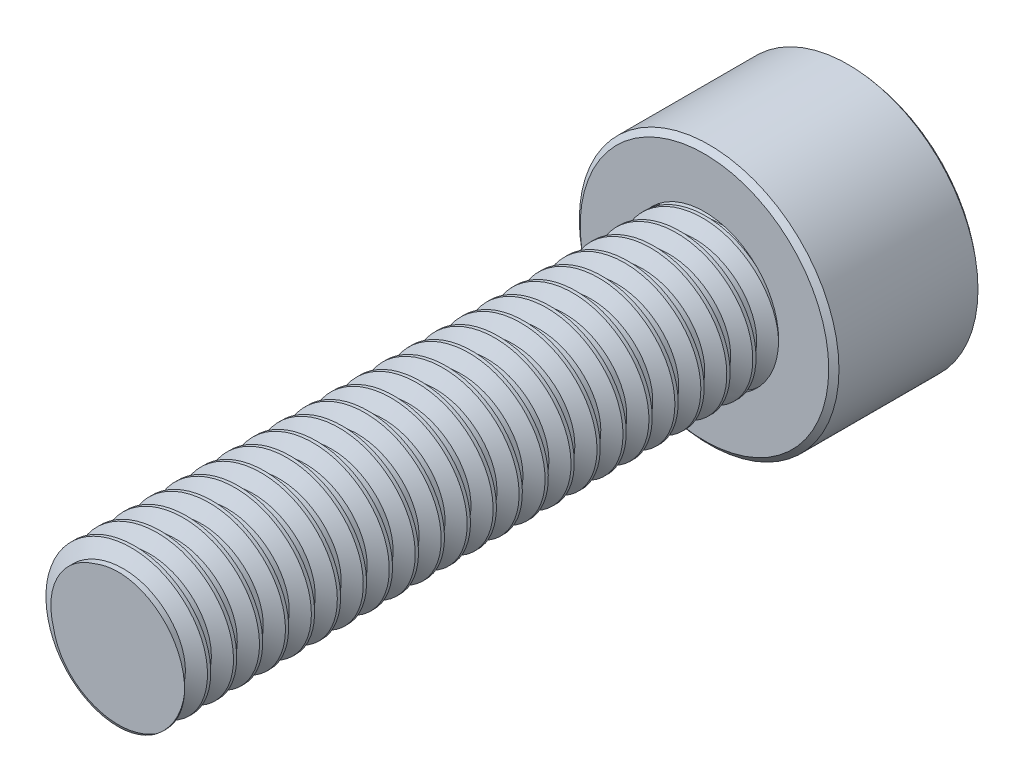
from build123d import *

# Parameters (mm, degrees)
SKETCH3_R           = 2
BOSS_EXTRUDE2_DEPTH = 16
SKETCH4_R           = 3.5
BOSS_EXTRUDE3_DEPTH = 4
SKETCH5_OUTSIDE_W   = 22.998
SKETCH5_OUTSIDE_H   = 22.998
SKETCH5_OUTSIDE_R   = 3.35
CUT_EXTRUDE1_DEPTH  = 4
CUT_EXTRUDE1_DRAFT  = -50
SKETCH6_OUTSIDE_W   = 22.998
SKETCH6_OUTSIDE_H   = 22.998
SKETCH6_OUTSIDE_R   = 3.35
CUT_EXTRUDE2_DEPTH  = 4
CUT_EXTRUDE2_DRAFT  = -50
THREAD1_PITCH       = 0.7
CUT_EXTRUDE3_DEPTH  = 2.8
FILLET2_R           = 0.1
FILLET3_R           = 0.1


with BuildPart() as part:
    # Sketch3 → Boss-Extrude2 (new body)
    with BuildSketch(Plane.XY):
        Circle(SKETCH3_R)
    extrude(amount=BOSS_EXTRUDE2_DEPTH)

    # Sketch4 → Boss-Extrude3 (add)
    with BuildSketch(Plane(origin=(0, 0, 0), x_dir=(-1, 0, 0), z_dir=(0, 0, -1))):
        Circle(SKETCH4_R)
    extrude(amount=BOSS_EXTRUDE3_DEPTH)


with BuildPart() as cut_extrude1_tool:
    # Sketch5 outside → Cut-Extrude1 (with draft: the straight prism first)
    with BuildSketch(Plane(origin=(0, 0, -4), x_dir=(-1, 0, 0), z_dir=(0, 0, -1))):
        Rectangle(SKETCH5_OUTSIDE_W, SKETCH5_OUTSIDE_H)
        Circle(SKETCH5_OUTSIDE_R, mode=Mode.SUBTRACT)
    extrude(amount=-CUT_EXTRUDE1_DEPTH)
    # Cut-Extrude1: the draft: its side faces are tilted about the plane it starts from
    cut_extrude1_sides = [cut_extrude1_tool.faces().sort_by_distance(p)[0] for p in [
        (0, -11.499, -2),
        (-11.499, 0, -2),
        (0, 11.499, -2),
        (11.499, 0, -2),
        (3.35, 0, -2),
    ]]
    draft(cut_extrude1_sides, Plane(origin=(0, 0, -4), x_dir=(-1, 0, 0), z_dir=(0, 0, -1)), CUT_EXTRUDE1_DRAFT)


with BuildPart() as part_1:
    add(part.part)

    # Cut-Extrude1: cut by cut_extrude1_tool
    add(cut_extrude1_tool.part, mode=Mode.SUBTRACT)


with BuildPart() as cut_extrude2_tool:
    # Sketch6 outside → Cut-Extrude2 (with draft: the straight prism first)
    with BuildSketch(Plane.XY):
        Rectangle(SKETCH6_OUTSIDE_W, SKETCH6_OUTSIDE_H)
        Circle(SKETCH6_OUTSIDE_R, mode=Mode.SUBTRACT)
    extrude(amount=-CUT_EXTRUDE2_DEPTH)
    # Cut-Extrude2: the draft: its side faces are tilted about the plane it starts from
    cut_extrude2_sides = [cut_extrude2_tool.faces().sort_by_distance(p)[0] for p in [
        (0, -11.499, -2),
        (11.499, 0, -2),
        (0, 11.499, -2),
        (-11.499, 0, -2),
        (-3.35, 0, -2),
    ]]
    draft(cut_extrude2_sides, Plane.XY, CUT_EXTRUDE2_DRAFT)


with BuildPart() as part_2:
    add(part_1.part)

    # Cut-Extrude2: cut by cut_extrude2_tool
    add(cut_extrude2_tool.part, mode=Mode.SUBTRACT)

    # Thread1: the profile of Thread Profile1 profile screwed along a right-hand helix of 28.571429 turns, 6 arcs to a turn; built about Z, then put on its axis
    thread1_z = Axis((0, 0, 0), (0, 0, 1))
    thread1_corners = [(2.0003, 0, -0.000173205), (2.0003, 0, 0.612673203), (1.621113888, 0, 0.393749999), (1.621113888, 0, 0.218749999)]
    with BuildLine(mode=Mode.PRIVATE) as thread1_profile:
        Line(thread1_corners[0], thread1_corners[1])
        Line(thread1_corners[1], thread1_corners[2])
        Line(thread1_corners[2], thread1_corners[3])
        Line(thread1_corners[3], thread1_corners[0])
    thread1_cap = Face(thread1_profile.wire())
    thread1_turn_angles = [0, 30, 60, 90, 120, 150, 180, 210, 240, 270, 300, 330, 360]
    thread1_turn_weights = [1, 0.8660254037844387, 1, 0.8660254037844387, 1, 0.8660254037844387, 1, 0.8660254037844387, 1, 0.8660254037844387, 1, 0.8660254037844387, 1]
    thread1_turn_rails = [Edge.make_bspline([Vector(p[0], p[1], 0).rotate(thread1_z, thread1_turn_angles[k]) / thread1_turn_weights[k] + Vector(0, 0, p[2] + THREAD1_PITCH * thread1_turn_angles[k] / 360) for k in range(13)], [0, 0, 0, 1, 1, 2, 2, 3, 3, 4, 4, 5, 5, 6, 6, 6], 2, thread1_turn_weights) for p in thread1_corners]
    thread1_turn_sides = [Face.make_surface_from_curves(thread1_turn_rails[p[0]], thread1_turn_rails[p[1]]) for p in [(0, 1), (1, 2), (2, 3), (3, 0)]]
    thread1_last_angles = [10080, 10110, 10140, 10170, 10200, 10230, 10260, 10272.857142857, 10285.714285714]
    thread1_last_weights = [1, 0.8660254037844387, 1, 0.8660254037844387, 1, 0.8660254037844387, 1, 0.9749279121818226, 1]
    thread1_last_rails = [Edge.make_bspline([Vector(p[0], p[1], 0).rotate(thread1_z, thread1_last_angles[k]) / thread1_last_weights[k] + Vector(0, 0, p[2] + THREAD1_PITCH * thread1_last_angles[k] / 360) for k in range(9)], [0, 0, 0, 1, 1, 2, 2, 3, 3, 4, 4, 4], 2, thread1_last_weights) for p in thread1_corners]
    thread1_last_sides = [Face.make_surface_from_curves(thread1_last_rails[p[0]], thread1_last_rails[p[1]]) for p in [(0, 1), (1, 2), (2, 3), (3, 0)]]
    thread1 = Plane(origin=(0, 0, -0.7), x_dir=(1, 0, 0), z_dir=(0, 0, 1)) * Solid(Shell([*[p.moved(Location((0, 0, THREAD1_PITCH * i))) for i in range(28) for p in thread1_turn_sides], *thread1_last_sides, thread1_cap, thread1_cap.rotate(thread1_z, 10285.714285714).moved(Location((0, 0, THREAD1_PITCH * 10285.714285714 / 360)))]))
    add(thread1, mode=Mode.SUBTRACT)

    # Sketch12 → Cut-Extrude3 (cut)
    with BuildSketch(Plane(origin=(0, 0, -4), x_dir=(-1, 0, 0), z_dir=(0, 0, -1))):
        Polygon((-1.07401049, -1.04713966), (0.369844302, -1.453690198), (1.443854792, -0.406550538), (1.07401049, 1.04713966), (-0.369844302, 1.453690198), (-1.443854792, 0.406550538), align=None)
    extrude(amount=-CUT_EXTRUDE3_DEPTH, mode=Mode.SUBTRACT)

    # Fillet2
    fillet2_edges = [part_2.edges().sort_by_distance(p)[0] for p in [
        (1.258932641, -0.320294561, -1.2),
        (1.07401049, -1.04713966, -2.6),
        (0.906849547, 0.930120368, -1.2),
        (1.443854792, 0.406550538, -2.6),
        (-0.352083094, 1.250414929, -1.2),
        (0.369844302, 1.453690198, -2.6),
        (-1.258932641, 0.320294561, -1.2),
        (-1.07401049, 1.04713966, -2.6),
        (-0.906849547, -0.930120368, -1.2),
        (-1.443854792, -0.406550538, -2.6),
        (0.352083094, -1.250414929, -1.2),
        (-0.369844302, -1.453690198, -2.6),
    ]]
    fillet(fillet2_edges, radius=FILLET2_R)

    # Fillet3
    fillet3_edges = [part_2.edges().sort_by_distance(p)[0] for p in [
        (0.352083094, -1.250414929, -4),
        (1.258932641, -0.320294561, -4),
        (-0.906849547, -0.930120368, -4),
        (-1.258932641, 0.320294561, -4),
        (-0.352083094, 1.250414929, -4),
        (0.906849547, 0.930120368, -4),
        (1.428963784, 0.402357632, -4),
        (1.062933823, -1.036340122, -4),
        (-1.428963784, -0.402357632, -4),
        (-0.366029962, -1.438697754, -4),
        (-1.062933823, 1.036340122, -4),
        (0.366029962, 1.438697754, -4),
    ]]
    fillet(fillet3_edges, radius=FILLET3_R)


solid = part_2.part
